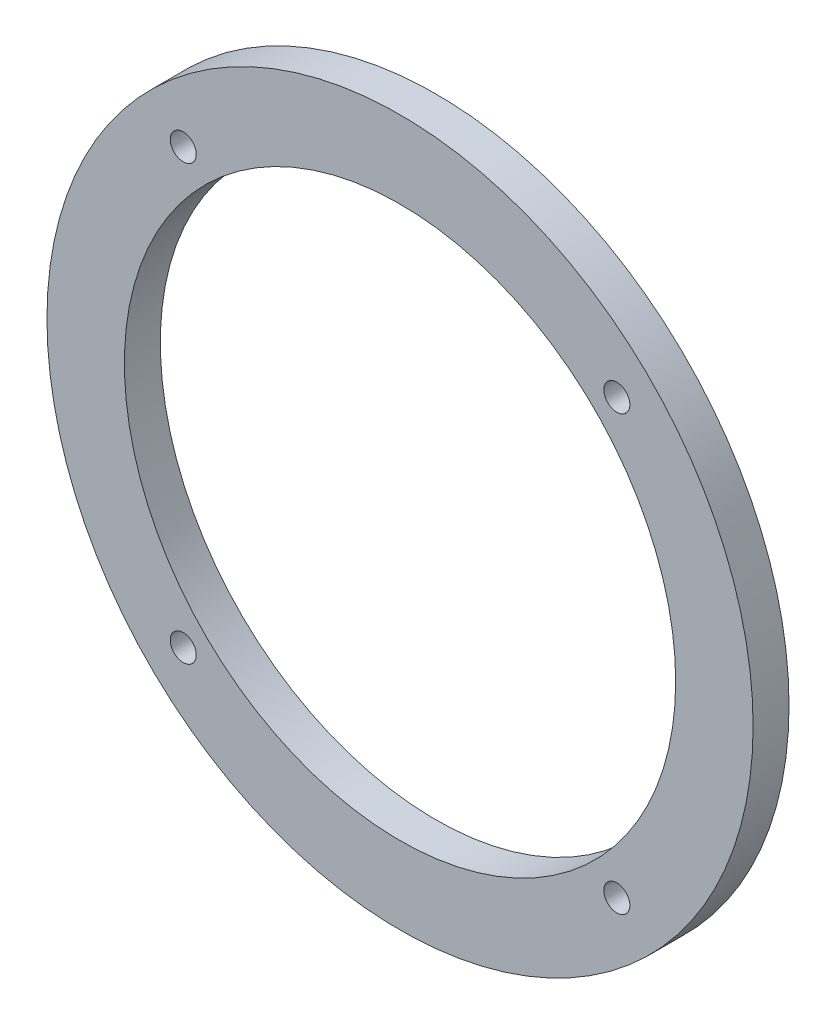
from build123d import *

# Parameters (mm, degrees)
SKETCH_1_R          = 57
SKETCH_1_R_2        = 44.5
EXTRUDE_1_DEPTH     = 5.8
SKETCH_2_R          = 2.1
CUT_EXTRUDE_1_DEPTH = 81.818562224


with BuildPart() as part:
    # ｽｹｯﾁ1 → ﾎﾞｽ - 押し出し1 (new body)
    with BuildSketch(Plane.XY):
        Circle(SKETCH_1_R)
        Circle(SKETCH_1_R_2, mode=Mode.SUBTRACT)
    extrude(amount=EXTRUDE_1_DEPTH)

    # ｽｹｯﾁ2 → ｶｯﾄ - 押し出し1 (cut, through all)
    with BuildSketch(Plane.XY.offset(5.8)):
        with Locations((35, 35)):
            Circle(SKETCH_2_R)
        with Locations((35, -35)):
            Circle(SKETCH_2_R)
        with Locations((-35, -35)):
            Circle(SKETCH_2_R)
        with Locations((-35, 35)):
            Circle(SKETCH_2_R)
    extrude(amount=-CUT_EXTRUDE_1_DEPTH, mode=Mode.SUBTRACT)


solid = part.part
